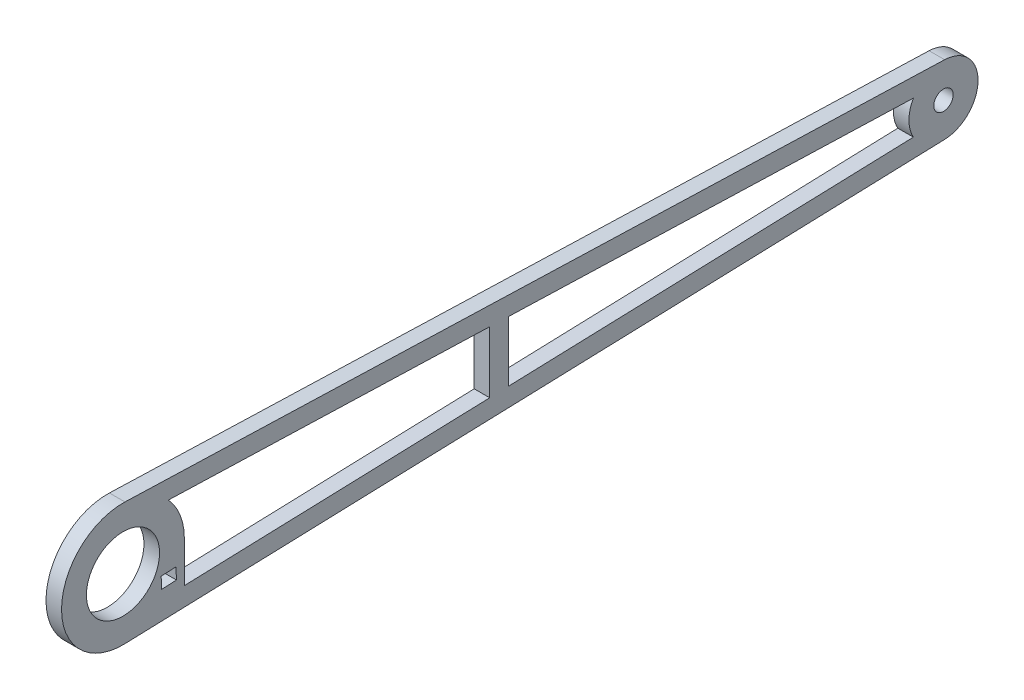
from build123d import *

# Parameters (mm, degrees)
SKETCH1_R           = 0.9906
SKETCH1_R_2         = 3.7338
BOSS_EXTRUDE1_DEPTH = 1.5875


with BuildPart() as part:
    # Sketch1 → Boss-Extrude1 (new body)
    with BuildSketch(Plane(origin=(0, 0, 0), x_dir=(0, 0, -1), z_dir=(1, 0, 0))):
        with BuildLine():
            Line((83.935546909, 3.528708726), (0.205324364, 6.270439247))
            ThreePointArc((0.205324364, 6.270439247), (-6.2738, 2.3e-08), (0.205324317, -6.270439248))
            Line((0.205324317, -6.270439248), (83.935546909, -3.528708726))
            ThreePointArc((83.935546909, -3.528708726), (87.3506, 0), (83.935546909, 3.528708726))
        make_face()
        with BuildLine():
            Line((39.37, 3.081978229), (80.740783809, 1.727299629))
            ThreePointArc((80.740783809, 1.727299629), (80.2894, 0), (80.740783809, -1.727299629))
            Line((80.740783809, -1.727299629), (39.37, -3.081978229))
            Line((39.37, -3.081978229), (39.37, 3.081978229))
        make_face(mode=Mode.SUBTRACT)
        with BuildLine():
            Line((4.643249776, 4.219099188), (37.465, 3.144357099))
            Line((37.465, 3.144357099), (37.465, -3.144357099))
            Line((37.465, -3.144357099), (6.2738, -4.165707125))
            Line((6.2738, -4.165707125), (6.2738, 0))
            ThreePointArc((6.2738, 0), (5.85198201, 2.261608498), (4.643249776, 4.219099188))
        make_face(mode=Mode.SUBTRACT)
        with Locations((83.82, 0)):
            Circle(SKETCH1_R, mode=Mode.SUBTRACT)
        Circle(SKETCH1_R_2, mode=Mode.SUBTRACT)
        Polygon((5.410734642, -2.075241046), (5.466135055, -3.267754876), (3.956463292, -3.337889441), (3.901062879, -2.145375611), align=None, mode=Mode.SUBTRACT)
    extrude(amount=BOSS_EXTRUDE1_DEPTH)


solid = part.part
